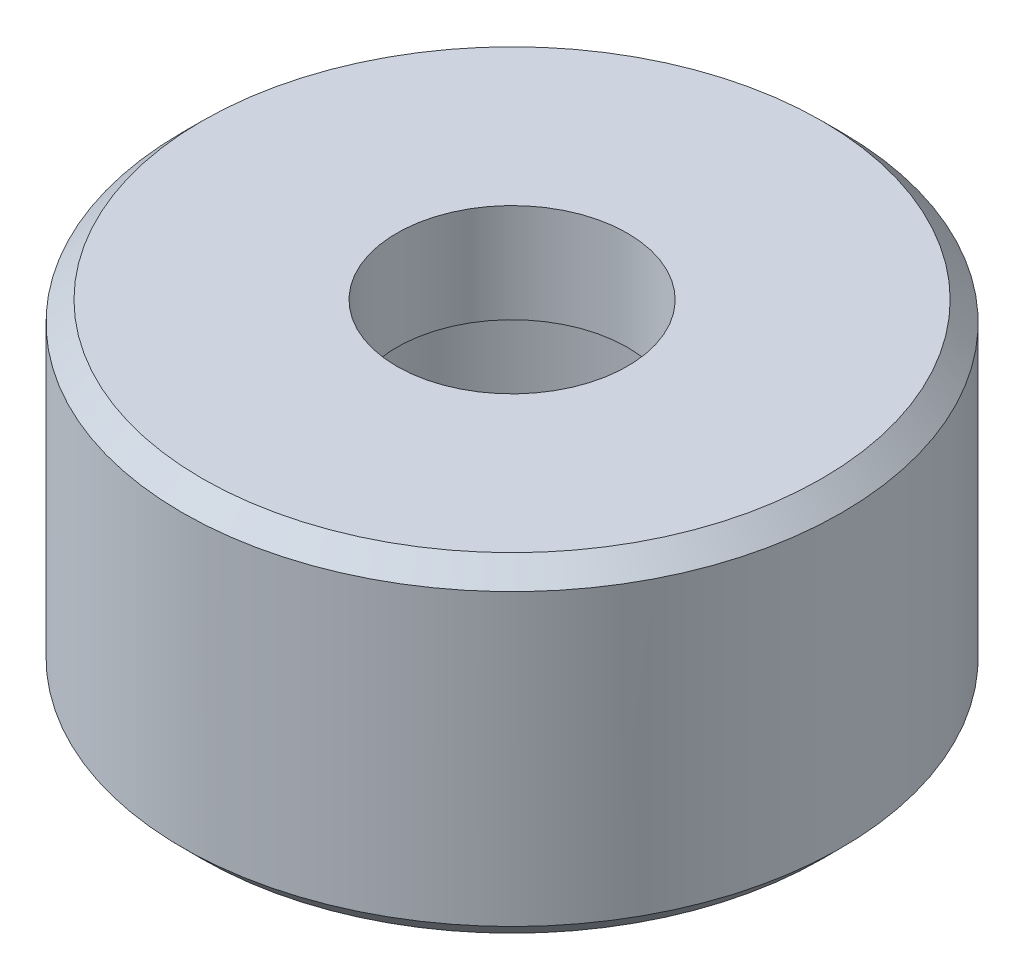
from build123d import *

# Parameters (mm, degrees)
CHAMFER1_SIZE = 0.3


with BuildPart() as part:
    # Sketch2 → Revolve1 (revolve)
    with BuildSketch(Plane(origin=(0, 0, 0), x_dir=(0, 0, -1), z_dir=(1, 0, 0))):
        Polygon((1.75, 5), (1.75, 3.5), (3, 3.5), (3, 0), (5, 0), (5, 5), align=None)
    revolve(axis=Axis((0, 0, 0), (0, 1, 0)))

    # Chamfer1
    chamfer1_edges = [part.edges().sort_by_distance(p)[0] for p in [
        (0, 0, 5),
        (0, 5, 5),
    ]]
    chamfer(chamfer1_edges, length=CHAMFER1_SIZE)


solid = part.part
